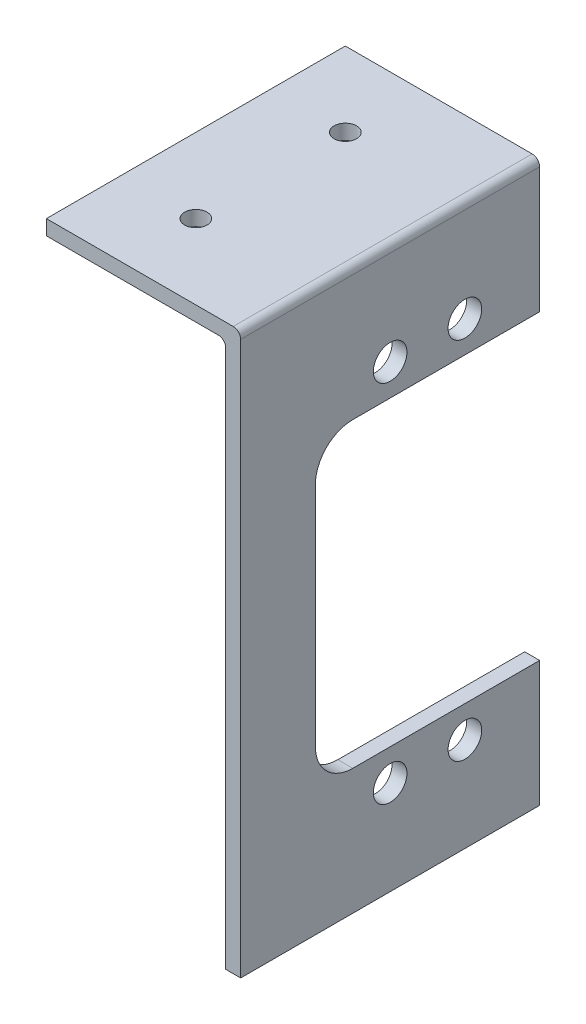
from build123d import *

# Parameters (mm, degrees)
SKETCH1_W           = 25
SKETCH1_H           = 40
SKETCH1_R           = 1.5
BOSS_EXTRUDE1_DEPTH = 2
BOSS_EXTRUDE2_DEPTH = 75
FILLET1_R           = 1
SKETCH3_R           = 2.25
CUT_EXTRUDE1_DEPTH  = 75
SKETCH4_W           = 30
SKETCH4_H           = 40.4
CUT_EXTRUDE2_DEPTH  = 10
SKETCH5_W           = 1
SKETCH5_H           = 6.8
BOSS_EXTRUDE3_DEPTH = 2
FILLET2_R           = 5


with BuildPart() as part:
    # Sketch1 → Boss-Extrude1 (new body)
    with BuildSketch(Plane(origin=(0, 0, 0), x_dir=(1, 0, 0), z_dir=(0, 1, 0))):
        with Locations((12.5, 20)):
            Rectangle(SKETCH1_W, SKETCH1_H)
        with Locations((10, 30)):
            Circle(SKETCH1_R, mode=Mode.SUBTRACT)
        with Locations((10, 10)):
            Circle(SKETCH1_R, mode=Mode.SUBTRACT)
    extrude(amount=BOSS_EXTRUDE1_DEPTH)

    # Sketch2 → Boss-Extrude2 (add)
    with BuildSketch(Plane(origin=(0, 2, 0), x_dir=(1, 0, 0), z_dir=(0, 1, 0))):
        Polygon((25, 40), (24, 40), (24, 0), (25, 0), (26, 0), (26, 40), align=None)
    extrude(amount=-BOSS_EXTRUDE2_DEPTH)

    # Fillet1
    fillet1_edges = [part.edges().sort_by_distance(p)[0] for p in [
        (24, 0, -20),
        (26, 2, -20),
    ]]
    fillet(fillet1_edges, radius=FILLET1_R)

    # Sketch3 → Cut-Extrude1 (cut)
    with BuildSketch(Plane.ZY.offset(-24)):
        Polygon((-24.5, -9), (-25.5, -9), (-25.5, -15.8), (-35, -15.8), (-35, -56.2), (-25.5, -56.2), (-25.5, -63), (-24.5, -63), (-24.5, -56.2), (-15, -56.2), (-15, -15.8), (-24.5, -15.8), align=None)
        with Locations((-30, -11.6)):
            Circle(SKETCH3_R)
        with Locations((-20, -11.6)):
            Circle(SKETCH3_R)
        with Locations((-20, -60.4)):
            Circle(SKETCH3_R)
        with Locations((-30, -60.4)):
            Circle(SKETCH3_R)
    extrude(amount=-CUT_EXTRUDE1_DEPTH, mode=Mode.SUBTRACT)

    # Sketch4 → Cut-Extrude2 (cut)
    with BuildSketch(Plane(origin=(26, 0, 0), x_dir=(0, 0, -1), z_dir=(1, 0, 0))):
        with Locations((25, -36)):
            Rectangle(SKETCH4_W, SKETCH4_H)
    extrude(amount=-CUT_EXTRUDE2_DEPTH, mode=Mode.SUBTRACT)

    # Sketch5 → Boss-Extrude3 (add)
    with BuildSketch(Plane(origin=(26, 0, 0), x_dir=(0, 0, -1), z_dir=(1, 0, 0))):
        with Locations((25, -12.4)):
            Rectangle(SKETCH5_W, SKETCH5_H)
        with Locations((25, -59.6)):
            Rectangle(SKETCH5_W, SKETCH5_H)
    extrude(amount=-BOSS_EXTRUDE3_DEPTH)

    # Fillet2
    fillet2_edges = [part.edges().sort_by_distance(p)[0] for p in [
        (25, -15.8, -10),
        (25, -56.2, -10),
    ]]
    fillet(fillet2_edges, radius=FILLET2_R)


solid = part.part
